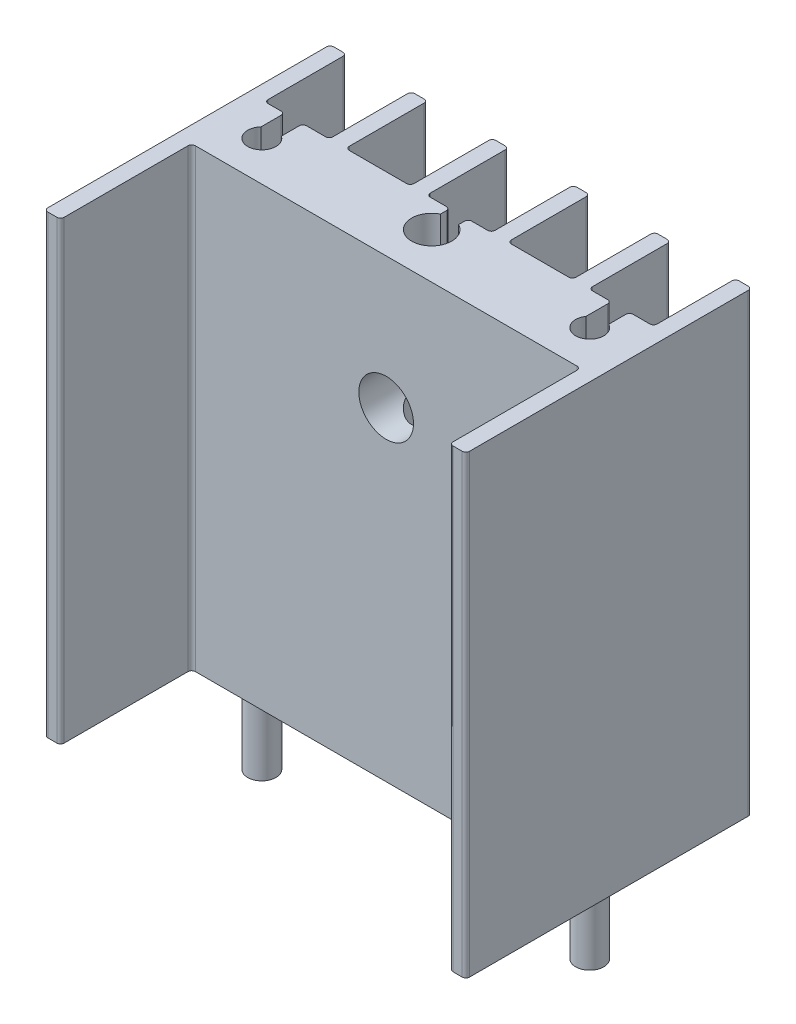
from build123d import *

# Parameters (mm, degrees)
EXTRUDE_1_DEPTH      = 25
EXTRUDE_2_DEPTH      = 5
EXTRUDE_2_DEPTH_BACK = 20
SKETCH_2_R           = 0.775
FILLET_1_R           = 0.2
SKETCH_3_R           = 1.5
CUT_EXTRUDE_1_DEPTH  = 10


with BuildPart() as part:
    # 草图1 → 凸台-拉伸1 (new body)
    with BuildSketch(Plane(origin=(0, 0, 0), x_dir=(1, 0, 0), z_dir=(0, 1, 0))):
        with BuildLine():
            Line((-11.375, -7.85), (-10.875, -7.85))
            ThreePointArc((-10.875, -7.85), (-10.733578644, -7.791421356), (-10.675, -7.65))
            Line((-10.675, -7.65), (-10.675, -0.65))
            Line((-10.675, -0.65), (10.675, -0.65))
            Line((10.675, -0.65), (10.675, -7.65))
            ThreePointArc((10.675, -7.65), (10.733578644, -7.791421356), (10.875, -7.85))
            Line((10.875, -7.85), (11.375, -7.85))
            ThreePointArc((11.375, -7.85), (11.516421356, -7.791421356), (11.575, -7.65))
            Line((11.575, -7.65), (11.575, 7.65))
            ThreePointArc((11.575, 7.65), (11.516421356, 7.791421356), (11.375, 7.85))
            Line((11.375, 7.85), (10.875, 7.85))
            ThreePointArc((10.875, 7.85), (10.733578644, 7.791421356), (10.675, 7.65))
            Line((10.675, 7.65), (10.675, 3.55))
            ThreePointArc((10.675, 3.55), (10.616421356, 3.408578644), (10.475, 3.35))
            Line((10.475, 3.35), (9.558099354, 3.35))
            ThreePointArc((9.558099354, 3.35), (9.416677998, 3.291421356), (9.358099354, 3.15))
            Line((9.358099354, 3.15), (9.358099354, 2.212306229))
            ThreePointArc((9.358099354, 2.212306229), (9.190112859, 0.773679762), (8.358099354, 1.959267845))
            Line((8.358099354, 1.959267845), (8.358099354, 3.15))
            ThreePointArc((8.358099354, 3.15), (8.29952071, 3.291421356), (8.158099354, 3.35))
            Line((8.158099354, 3.35), (7.325, 3.35))
            ThreePointArc((7.325, 3.35), (7.183578644, 3.408578644), (7.125, 3.55))
            Line((7.125, 3.55), (7.125, 7.65))
            ThreePointArc((7.125, 7.65), (7.066421356, 7.791421356), (6.925, 7.85))
            Line((6.925, 7.85), (6.425, 7.85))
            ThreePointArc((6.425, 7.85), (6.283578644, 7.791421356), (6.225, 7.65))
            Line((6.225, 7.65), (6.225, 3.55))
            ThreePointArc((6.225, 3.55), (6.166421356, 3.408578644), (6.025, 3.35))
            Line((6.025, 3.35), (2.875, 3.35))
            ThreePointArc((2.875, 3.35), (2.733578644, 3.408578644), (2.675, 3.55))
            Line((2.675, 3.55), (2.675, 7.65))
            ThreePointArc((2.675, 7.65), (2.616421356, 7.791421356), (2.475, 7.85))
            Line((2.475, 7.85), (1.975, 7.85))
            ThreePointArc((1.975, 7.85), (1.833578644, 7.791421356), (1.775, 7.65))
            Line((1.775, 7.65), (1.775, 3.55))
            ThreePointArc((1.775, 3.55), (1.716421356, 3.408578644), (1.575, 3.35))
            Line((1.575, 3.35), (0.7, 3.35))
            ThreePointArc((0.7, 3.35), (0.558578644, 3.291421356), (0.5, 3.15))
            Line((0.5, 3.15), (0.5, 2.829795897))
            ThreePointArc((0.5, 2.829795897), (0, 0.75), (-0.5, 2.829795897))
            Line((-0.5, 2.829795897), (-0.5, 3.15))
            ThreePointArc((-0.5, 3.15), (-0.558578644, 3.291421356), (-0.7, 3.35))
            Line((-0.7, 3.35), (-1.575, 3.35))
            ThreePointArc((-1.575, 3.35), (-1.716421356, 3.408578644), (-1.775, 3.55))
            Line((-1.775, 3.55), (-1.775, 7.65))
            ThreePointArc((-1.775, 7.65), (-1.833578644, 7.791421356), (-1.975, 7.85))
            Line((-1.975, 7.85), (-2.475, 7.85))
            ThreePointArc((-2.475, 7.85), (-2.616421356, 7.791421356), (-2.675, 7.65))
            Line((-2.675, 7.65), (-2.675, 3.55))
            ThreePointArc((-2.675, 3.55), (-2.733578644, 3.408578644), (-2.875, 3.35))
            Line((-2.875, 3.35), (-6.025, 3.35))
            ThreePointArc((-6.025, 3.35), (-6.166421356, 3.408578644), (-6.225, 3.55))
            Line((-6.225, 3.55), (-6.225, 7.65))
            ThreePointArc((-6.225, 7.65), (-6.283578644, 7.791421356), (-6.425, 7.85))
            Line((-6.425, 7.85), (-6.925, 7.85))
            ThreePointArc((-6.925, 7.85), (-7.066421356, 7.791421356), (-7.125, 7.65))
            Line((-7.125, 7.65), (-7.125, 3.55))
            ThreePointArc((-7.125, 3.55), (-7.183578644, 3.408578644), (-7.325, 3.35))
            Line((-7.325, 3.35), (-8.37016684, 3.35))
            ThreePointArc((-8.37016684, 3.35), (-8.511588196, 3.291421356), (-8.57016684, 3.15))
            Line((-8.57016684, 3.15), (-8.57016684, 2.169878635))
            ThreePointArc((-8.57016684, 2.169878635), (-8.907689329, 0.755517226), (-9.57016684, 2.049914064))
            Line((-9.57016684, 2.049914064), (-9.57016684, 3.15))
            ThreePointArc((-9.57016684, 3.15), (-9.628745484, 3.291421356), (-9.77016684, 3.35))
            Line((-9.77016684, 3.35), (-10.475, 3.35))
            ThreePointArc((-10.475, 3.35), (-10.616421356, 3.408578644), (-10.675, 3.55))
            Line((-10.675, 3.55), (-10.675, 7.65))
            ThreePointArc((-10.675, 7.65), (-10.733578644, 7.791421356), (-10.875, 7.85))
            Line((-10.875, 7.85), (-11.375, 7.85))
            ThreePointArc((-11.375, 7.85), (-11.516421356, 7.791421356), (-11.575, 7.65))
            Line((-11.575, 7.65), (-11.575, -7.65))
            ThreePointArc((-11.575, -7.65), (-11.516421356, -7.791421356), (-11.375, -7.85))
        make_face()
    extrude(amount=EXTRUDE_1_DEPTH)

    # 草图2 → 凸台-拉伸2 (add, two sides: drawn at the far end of the back side and taken through both)
    with BuildSketch(Plane.XZ.offset(-EXTRUDE_2_DEPTH_BACK)):
        with Locations((-9, -1.525)):
            Circle(SKETCH_2_R)
        with Locations((9, -1.525)):
            Circle(SKETCH_2_R)
    extrude(amount=EXTRUDE_2_DEPTH + EXTRUDE_2_DEPTH_BACK)

    # 圆角1
    fillet_1_edges = [part.edges().sort_by_distance(p)[0] for p in [
        (10.675, 12.5, 0.65),
        (-10.675, 12.5, 0.65),
    ]]
    fillet(fillet_1_edges, radius=FILLET_1_R)

    # 草图3 → 切除-拉伸1 (cut)
    with BuildSketch(Plane.XY.offset(0.65)):
        with Locations((0, 17.78)):
            Circle(SKETCH_3_R)
    extrude(amount=-CUT_EXTRUDE_1_DEPTH, mode=Mode.SUBTRACT)


solid = part.part
